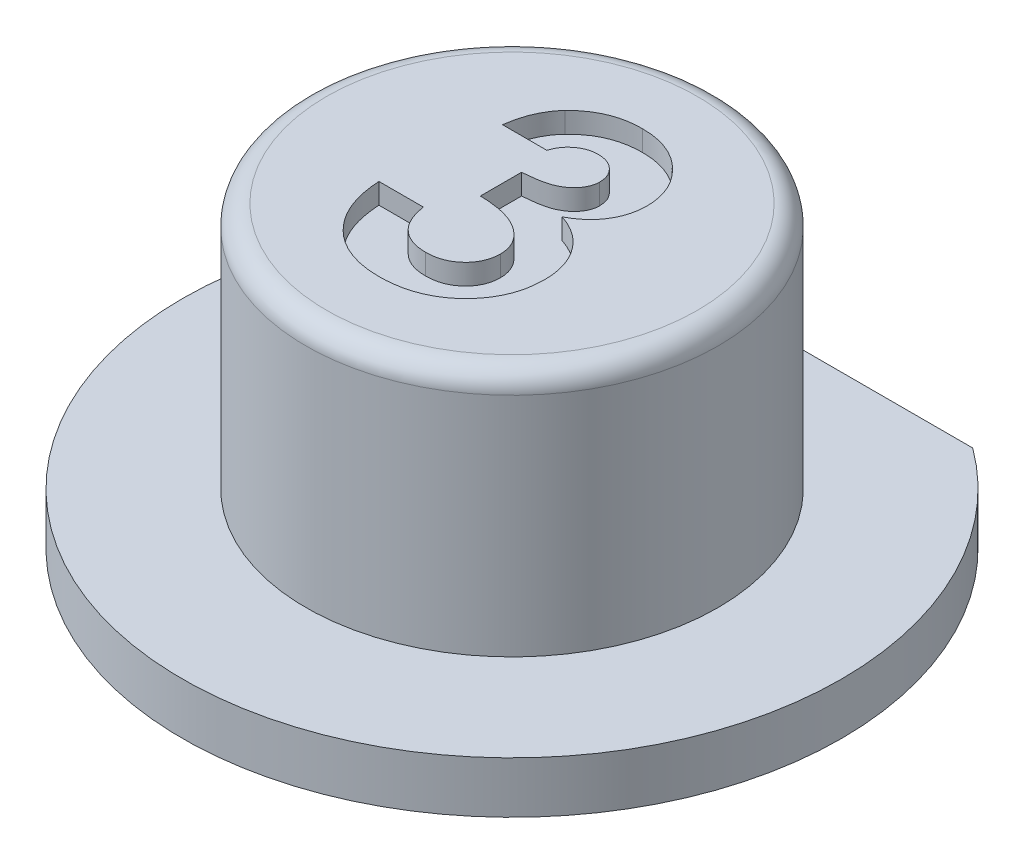
from build123d import *

# Parameters (mm, degrees)
SKETCH2_W          = 2.5
SKETCH2_H          = 3.5
CUT_EXTRUDE1_DEPTH = 3.5
FILLET1_R          = 0.5
CUT_EXTRUDE2_DEPTH = 0.5
SKETCH4_W          = 10
SKETCH4_H          = 3
CUT_EXTRUDE3_DEPTH = 14.437354704


with BuildPart() as part:
    # Sketch1 → Revolve1 (revolve)
    with BuildSketch(Plane.XY):
        Polygon((0, 7.25), (5, 7.25), (5, 1.25), (8, 1.25), (8, 0), (0, 0), align=None)
    revolve(axis=Axis((0, 7.25, 0), (0, -1, 0)))

    # Sketch2 → Cut-Extrude1 (cut)
    with BuildSketch(Plane.XZ):
        Rectangle(SKETCH2_W, SKETCH2_H)
    extrude(amount=-CUT_EXTRUDE1_DEPTH, mode=Mode.SUBTRACT)

    # Fillet1
    fillet1_edges = [part.edges().sort_by_distance(p)[0] for p in [
        (-5, 7.25, 0),
    ]]
    fillet(fillet1_edges, radius=FILLET1_R)

    # Sketch3 → Cut-Extrude2 (cut)
    with BuildSketch(Plane(origin=(0, 7.25, 0), x_dir=(1, 0, 0), z_dir=(0, 1, 0))):
        with BuildLine():
            Line((-0.692307692, 1.538461538), (-1.769230769, 1.538461538))
            add(Edge.make_bspline(
                [(-1.769230769, 1.538461538), (-1.761627283, 1.592293081), (-1.746721151, 1.697826255), (-1.711052772, 1.850612001), (-1.668389541, 1.995539737), (-1.615126677, 2.132150507), (-1.552658003, 2.26068766), (-1.481618755, 2.381592272), (-1.401240972, 2.494345399), (-1.339630551, 2.56226833), (-1.308894231, 2.596153846)],
                knots=[0, 0, 0, 0, 1.111473889, 2.178970933, 3.205615836, 4.199322666, 5.174200091, 6.12565194, 7.064921805, 8, 8, 8, 8], degree=3))
            add(Edge.make_bspline(
                [(-1.308894231, 2.596153846), (-1.264561162, 2.64086333), (-1.177185342, 2.728981023), (-1.0311701, 2.841850054), (-0.87811916, 2.939530525), (-0.714963019, 3.016972309), (-0.54424051, 3.079652462), (-0.364593988, 3.121754862), (-0.176757553, 3.149690176), (-0.048582817, 3.152441902), (0.016826923, 3.153846154)],
                knots=[0, 0, 0, 0, 1.01925491, 2.00884431, 2.983262333, 3.955970413, 4.92937149, 5.924503185, 6.940838805, 8, 8, 8, 8], degree=3))
            add(Edge.make_bspline(
                [(0.016826923, 3.153846154), (0.074979548, 3.152473284), (0.189295889, 3.1497745), (0.357312147, 3.12811012), (0.517501588, 3.09011321), (0.671557461, 3.040433102), (0.817214107, 2.972835014), (0.957686309, 2.894368021), (1.089049269, 2.798124993), (1.21161035, 2.689380057), (1.324206079, 2.571761763), (1.421714474, 2.44603748), (1.50554419, 2.315565593), (1.574608788, 2.179262127), (1.627710079, 2.03689644), (1.66456395, 1.889290961), (1.688685703, 1.73677139), (1.69108886, 1.633105893), (1.692307692, 1.580528846)],
                knots=[0, 0, 0, 0, 1.091422571, 2.145516843, 3.172569842, 4.178562979, 5.178154469, 6.181868002, 7.194278174, 8.227918432, 9.254613415, 10.245994977, 11.209837596, 12.161663635, 13.10878368, 14.055455738, 15.013766427, 16, 16, 16, 16], degree=3))
            add(Edge.make_bspline(
                [(1.692307692, 1.580528846), (1.689806575, 1.515416552), (1.684882644, 1.387230464), (1.644478223, 1.1996206), (1.581234318, 1.02023209), (1.489872345, 0.851574848), (1.37564661, 0.694107866), (1.235495458, 0.553095736), (1.073410758, 0.42632758), (0.951731615, 0.358202358), (0.889423077, 0.323317308)],
                knots=[0, 0, 0, 0, 0.992805628, 1.954529043, 2.915727527, 3.886831945, 4.871318353, 5.87440735, 6.911542536, 8, 8, 8, 8], degree=3))
            add(Edge.make_bspline(
                [(0.889423077, 0.323317308), (0.932190702, 0.309275796), (1.016227167, 0.281684855), (1.135674897, 0.227344809), (1.249256039, 0.167960147), (1.355014768, 0.098970823), (1.45400298, 0.02316646), (1.545617233, -0.060100944), (1.6304049, -0.150649828), (1.706981857, -0.248978177), (1.774946898, -0.353513419), (1.83592831, -0.461840853), (1.886119412, -0.575603284), (1.928637524, -0.693501468), (1.961008393, -0.816595012), (1.983800378, -0.944406938), (1.996974705, -1.0766457), (1.998984014, -1.166237381), (2, -1.211538462)],
                knots=[0, 0, 0, 0, 1.059543567, 2.081955587, 3.086750234, 4.076226789, 5.052108497, 6.020845489, 6.989030705, 7.970690546, 8.952259656, 9.923888338, 10.895517021, 11.877585046, 12.873342345, 13.889638361, 14.932918083, 16, 16, 16, 16], degree=3))
            add(Edge.make_bspline(
                [(2, -1.211538462), (1.99794046, -1.278112657), (1.993879466, -1.409383412), (1.96806157, -1.602731801), (1.919993298, -1.787072311), (1.856756824, -1.964526059), (1.772406231, -2.132802181), (1.673139763, -2.295762385), (1.55112133, -2.447755255), (1.415518792, -2.59279909), (1.264924269, -2.72466645), (1.101655307, -2.838989517), (0.92930205, -2.937099049), (0.746774068, -3.016747163), (0.554134775, -3.07808532), (0.351813548, -3.122423367), (0.138960288, -3.149550117), (-0.006328716, -3.152393843), (-0.080528846, -3.153846154)],
                knots=[0, 0, 0, 0, 1.005138573, 1.981928558, 2.936866704, 3.876260664, 4.820238198, 5.773547, 6.751179199, 7.756627054, 8.768222608, 9.766606018, 10.760583154, 11.757261445, 12.767156078, 13.807575856, 14.880313354, 16, 16, 16, 16], degree=3))
            add(Edge.make_bspline(
                [(-0.080528846, -3.153846154), (-0.150720973, -3.152314938), (-0.287972388, -3.149320847), (-0.488731308, -3.123405473), (-0.679533658, -3.081601873), (-0.860866369, -3.022676231), (-1.032027879, -2.946259745), (-1.194570348, -2.855264855), (-1.345250276, -2.744443189), (-1.485746535, -2.618797446), (-1.612942493, -2.477830056), (-1.726625726, -2.324806459), (-1.824289498, -2.15914477), (-1.90633433, -1.981552763), (-1.972118816, -1.791718889), (-2.024009425, -1.590029185), (-2.060255866, -1.376089611), (-2.071294795, -1.228894633), (-2.076923077, -1.153846154)],
                knots=[0, 0, 0, 0, 1.066544725, 2.085487077, 3.070979577, 4.031932826, 4.977951092, 5.916076795, 6.857635327, 7.814973522, 8.776389752, 9.738577119, 10.707772778, 11.69409279, 12.707140348, 13.757286496, 14.856535458, 16, 16, 16, 16], degree=3))
            Line((-2.076923077, -1.153846154), (-1, -1.153846154))
            add(Edge.make_bspline(
                [(-1, -1.153846154), (-0.993175651, -1.191581514), (-0.979883441, -1.265081025), (-0.953957801, -1.371491977), (-0.920173075, -1.469715859), (-0.881109526, -1.56062568), (-0.838915012, -1.645415056), (-0.78793395, -1.720952506), (-0.731901962, -1.78928918), (-0.651047396, -1.870528571), (-0.535460225, -1.953998654), (-0.37937925, -2.026538127), (-0.205753946, -2.069055171), (-0.084372543, -2.074242119), (-0.021634615, -2.076923077)],
                knots=[0, 0, 0, 0, 0.928156231, 1.807827665, 2.648129825, 3.438902246, 4.202261636, 4.936546065, 5.639352463, 6.338805438, 7.70633318, 9.064371875, 10.482673459, 12, 12, 12, 12], degree=3))
            add(Edge.make_bspline(
                [(-0.021634615, -2.076923077), (0.011656347, -2.076352192), (0.076865893, -2.075233957), (0.172649007, -2.062839815), (0.26389591, -2.042426653), (0.350776553, -2.014685923), (0.433844025, -1.979911184), (0.511511237, -1.935071238), (0.585361242, -1.8829384), (0.654591223, -1.824327251), (0.718561152, -1.760462079), (0.771787895, -1.689742251), (0.820433287, -1.617878267), (0.856411769, -1.54016853), (0.88793667, -1.460794654), (0.90723152, -1.376875618), (0.921800518, -1.290171816), (0.92264721, -1.23083554), (0.923076923, -1.200721154)],
                knots=[0, 0, 0, 0, 1.110435564, 2.175094844, 3.216326037, 4.226890168, 5.215276772, 6.21526065, 7.213097102, 8.228249917, 9.239874822, 10.221364777, 11.178138315, 12.128914389, 13.072518965, 14.022636769, 14.996447288, 16, 16, 16, 16], degree=3))
            add(Edge.make_bspline(
                [(0.923076923, -1.200721154), (0.921936114, -1.167785942), (0.919665025, -1.102219481), (0.901109988, -1.006539018), (0.871807663, -0.914502124), (0.831103154, -0.826516381), (0.776746819, -0.742906088), (0.71260695, -0.66199377), (0.633630386, -0.587990767), (0.546982519, -0.514841041), (0.446505033, -0.451076542), (0.337091322, -0.392231279), (0.215865824, -0.345408616), (0.085787762, -0.303587306), (-0.055603411, -0.27304167), (-0.207429711, -0.250862562), (-0.369446217, -0.234353653), (-0.481126301, -0.231985178), (-0.538461538, -0.230769231)],
                knots=[0, 0, 0, 0, 0.809814727, 1.612155564, 2.388397, 3.182215007, 3.988903953, 4.837162975, 5.715530372, 6.646997145, 7.623086902, 8.637258368, 9.698941581, 10.815059213, 11.996518529, 13.252603015, 14.589518788, 16, 16, 16, 16], degree=3))
            Line((-0.538461538, -0.230769231), (-0.538461538, 0.769230769))
            add(Edge.make_bspline(
                [(-0.538461538, 0.769230769), (-0.467075758, 0.775310211), (-0.333527098, 0.786683642), (-0.148154398, 0.813280806), (0.007905519, 0.848832295), (0.138403557, 0.891723242), (0.246760767, 0.946806392), (0.341421027, 1.007615757), (0.42294692, 1.078236948), (0.491847236, 1.156564051), (0.546965345, 1.240680013), (0.585974732, 1.329277425), (0.611734493, 1.419614974), (0.614175229, 1.481403134), (0.615384615, 1.512019231)],
                knots=[0, 0, 0, 0, 1.70044513, 3.18119609, 4.440695891, 5.496282586, 6.431922213, 7.318171381, 8.16090191, 8.983045123, 9.787564368, 10.536848927, 11.275007137, 12, 12, 12, 12], degree=3))
            add(Edge.make_bspline(
                [(0.615384615, 1.512019231), (0.613298077, 1.551082046), (0.609225595, 1.627324392), (0.577596497, 1.73644325), (0.522691967, 1.833713668), (0.449074632, 1.918930961), (0.35936935, 1.990110831), (0.254219034, 2.041786203), (0.135905452, 2.072147791), (0.052665473, 2.075295265), (0.009615385, 2.076923077)],
                knots=[0, 0, 0, 0, 1.009664648, 1.970651636, 2.907870547, 3.878035693, 4.867062054, 5.849714035, 6.887914197, 8, 8, 8, 8], degree=3))
            add(Edge.make_bspline(
                [(0.009615385, 2.076923077), (-0.02940468, 2.07500243), (-0.106832439, 2.071191279), (-0.220054998, 2.042745855), (-0.327578707, 1.994861524), (-0.427177053, 1.928831853), (-0.517412316, 1.849533017), (-0.591469432, 1.755620006), (-0.653066629, 1.652719311), (-0.679176059, 1.57669677), (-0.692307692, 1.538461538)],
                knots=[0, 0, 0, 0, 0.98818071, 1.960853194, 2.938124878, 3.957524365, 4.978590984, 5.968022688, 6.978025184, 8, 8, 8, 8], degree=3))
        make_face()
    extrude(amount=-CUT_EXTRUDE2_DEPTH, mode=Mode.SUBTRACT)

    # Sketch4 → Cut-Extrude3 (cut, through all)
    with BuildSketch(Plane(origin=(0, 0, 0), x_dir=(-1, 0, 0), z_dir=(0, -1, 0))):
        with Locations((0, 7.94974957)):
            Rectangle(SKETCH4_W, SKETCH4_H)
    extrude(amount=-CUT_EXTRUDE3_DEPTH, mode=Mode.SUBTRACT)


solid = part.part
